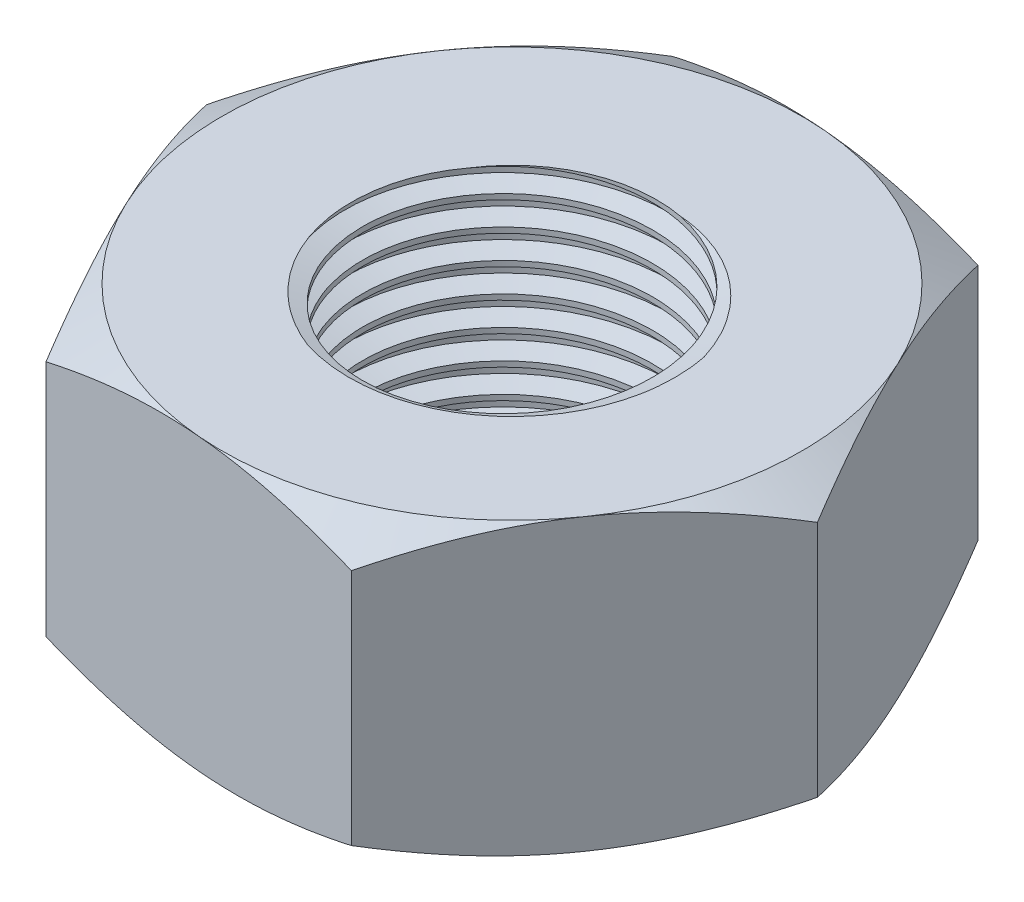
from build123d import *

# Parameters (mm, degrees)
BOSS_EXTRUDE1_DEPTH       = 10
SKETCH2_R                 = 22.760531654
SKETCH2_R_2               = 10
CUT_EXTRUDE8_DEPTH        = 2
CUT_EXTRUDE8_DRAFT        = -60
MIRROR2_COPY_1_SKETCH_R   = 22.760531654
MIRROR2_COPY_1_SKETCH_R_2 = 10
MIRROR2_COPY_1_DEPTH      = 2
MIRROR2_COPY_1_DRAFT      = -60
SKETCH4_R                 = 5
CUT_EXTRUDE9_DEPTH        = 20
CUT_SWEEP1_PITCH          = 1


with BuildPart() as part:
    # Sketch1 → Boss-Extrude1 (new body)
    with BuildSketch(Plane(origin=(0, 0, 0), x_dir=(1, 0, 0), z_dir=(0, 1, 0))):
        Polygon((-4.91091156, 10.450659356), (-11.505992269, 0.972355511), (-6.595080709, -9.478303845), (4.91091156, -10.450659356), (11.505992269, -0.972355511), (6.595080709, 9.478303845), align=None)
    extrude(amount=BOSS_EXTRUDE1_DEPTH)


with BuildPart() as cut_extrude8_tool:
    # Sketch2 → Cut-Extrude8 (with draft: the straight prism first)
    with BuildSketch(Plane(origin=(0, 10, 0), x_dir=(1, 0, 0), z_dir=(0, 1, 0))):
        Circle(SKETCH2_R)
        Circle(SKETCH2_R_2, mode=Mode.SUBTRACT)
    extrude(amount=-CUT_EXTRUDE8_DEPTH)
    # Cut-Extrude8: the draft: its side faces are tilted about the plane it starts from
    cut_extrude8_sides = [cut_extrude8_tool.faces().sort_by_distance(p)[0] for p in [
        (-22.760531654, 9, 0),
        (-10, 9, 0),
    ]]
    draft(cut_extrude8_sides, Plane(origin=(0, 10, 0), x_dir=(1, 0, 0), z_dir=(0, 1, 0)), CUT_EXTRUDE8_DRAFT)


with BuildPart() as part_1:
    add(part.part)

    # Cut-Extrude8: cut by cut_extrude8_tool
    add(cut_extrude8_tool.part, mode=Mode.SUBTRACT)


with BuildPart() as mirror2_copy_1_tool:
    # Mirror2 copy 1 sketch → Mirror2 copy 1 (with draft: the straight prism first)
    with BuildSketch(Plane.XZ):
        Circle(MIRROR2_COPY_1_SKETCH_R)
        Circle(MIRROR2_COPY_1_SKETCH_R_2, mode=Mode.SUBTRACT)
    extrude(amount=-MIRROR2_COPY_1_DEPTH)
    # Mirror2 copy 1: the draft: its side faces are tilted about the plane it starts from
    mirror2_copy_1_sides = [mirror2_copy_1_tool.faces().sort_by_distance(p)[0] for p in [
        (-22.760531654, 1, 0),
        (-10, 1, 0),
    ]]
    draft(mirror2_copy_1_sides, Plane.XZ, MIRROR2_COPY_1_DRAFT)


with BuildPart() as part_2:
    add(part_1.part)

    # Mirror2 copy 1: cut by mirror2_copy_1_tool
    add(mirror2_copy_1_tool.part, mode=Mode.SUBTRACT)

    # Sketch4 → Cut-Extrude9 (cut)
    with BuildSketch(Plane(origin=(0, 10, 0), x_dir=(1, 0, 0), z_dir=(0, 1, 0))):
        with Locations(Location((0, 0, 0), (0, 0, 270))):
            Circle(SKETCH4_R)
    extrude(amount=-CUT_EXTRUDE9_DEPTH, mode=Mode.SUBTRACT)

    # Cut-Sweep1: the profile of Sketch6 screwed along a right-hand helix of 17 turns, 8 arcs to a turn; built about Z, then put on its axis
    cut_sweep1_z = Axis((0, 0, 0), (0, 0, 1))
    cut_sweep1_corners = [(3.512483553, 3.512483553, 0.143092667), (3.512483553, 3.512483553, 0.981821316), (3.970999427, 3.970999427, 0.781610105), (3.970999427, 3.970999427, 0.451261606)]
    with BuildLine(mode=Mode.PRIVATE) as cut_sweep1_profile:
        Line(cut_sweep1_corners[0], cut_sweep1_corners[1])
        Line(cut_sweep1_corners[1], cut_sweep1_corners[2])
        Line(cut_sweep1_corners[2], cut_sweep1_corners[3])
        Line(cut_sweep1_corners[3], cut_sweep1_corners[0])
    cut_sweep1_cap = Face(cut_sweep1_profile.wire())
    cut_sweep1_turn_angles = [0, 22.5, 45, 67.5, 90, 112.5, 135, 157.5, 180, 202.5, 225, 247.5, 270, 292.5, 315, 337.5, 360]
    cut_sweep1_turn_weights = [1, 0.9238795325112867, 1, 0.9238795325112867, 1, 0.9238795325112867, 1, 0.9238795325112867, 1, 0.9238795325112867, 1, 0.9238795325112867, 1, 0.9238795325112867, 1, 0.9238795325112867, 1]
    cut_sweep1_turn_rails = [Edge.make_bspline([Vector(p[0], p[1], 0).rotate(cut_sweep1_z, cut_sweep1_turn_angles[k]) / cut_sweep1_turn_weights[k] + Vector(0, 0, p[2] + CUT_SWEEP1_PITCH * cut_sweep1_turn_angles[k] / 360) for k in range(17)], [0, 0, 0, 1, 1, 2, 2, 3, 3, 4, 4, 5, 5, 6, 6, 7, 7, 8, 8, 8], 2, cut_sweep1_turn_weights) for p in cut_sweep1_corners]
    cut_sweep1_turn_sides = [Face.make_surface_from_curves(cut_sweep1_turn_rails[p[0]], cut_sweep1_turn_rails[p[1]]) for p in [(0, 1), (1, 2), (2, 3), (3, 0)]]
    cut_sweep1 = Plane(origin=(0, 11, 0), x_dir=(-0.7071067811865537, 0, -0.7071067811865414), z_dir=(0, -1, 0)) * Solid(Shell([*[p.moved(Location((0, 0, CUT_SWEEP1_PITCH * i))) for i in range(17) for p in cut_sweep1_turn_sides], cut_sweep1_cap, cut_sweep1_cap.rotate(cut_sweep1_z, 6120).moved(Location((0, 0, CUT_SWEEP1_PITCH * 6120 / 360)))]))
    add(cut_sweep1, mode=Mode.SUBTRACT)


solid = part_2.part
